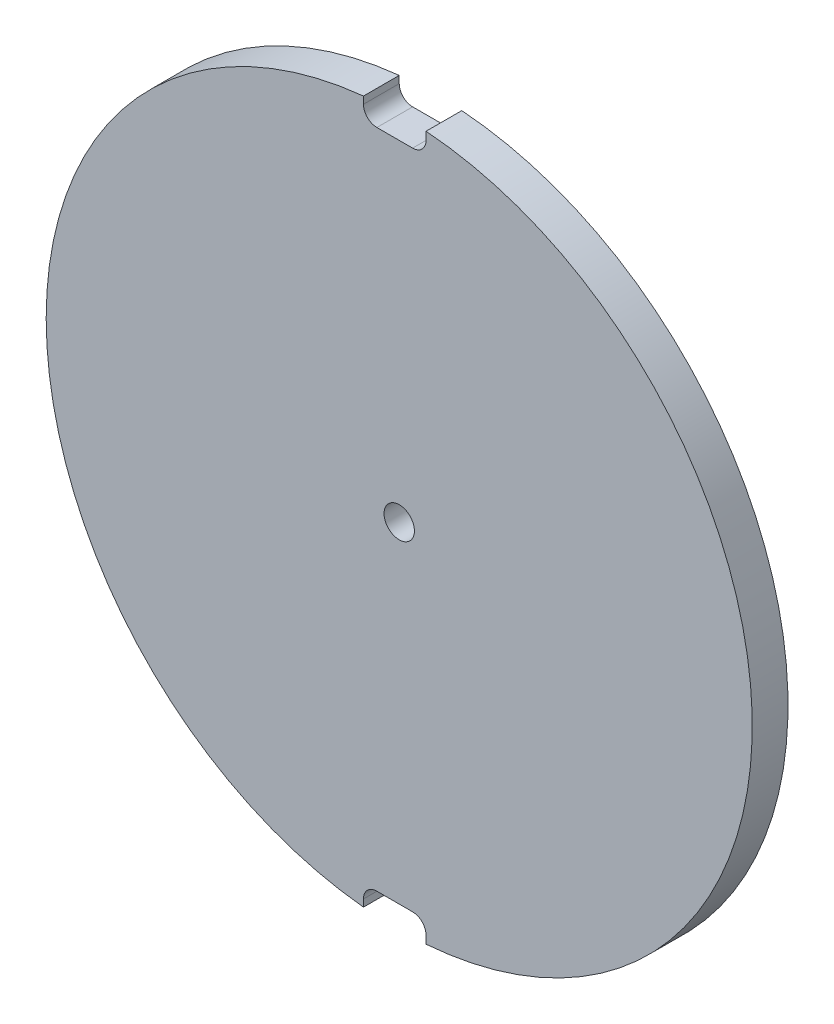
from build123d import *

# Parameters (mm, degrees)
SKETCH1_R           = 39.5
BOSS_EXTRUDE1_DEPTH = 4
CUT_EXTRUDE2_DEPTH  = 10
SKETCH7_R           = 26
BOSS_EXTRUDE2_DEPTH = 7
SKETCH8_R           = 1.7
CUT_EXTRUDE3_DEPTH  = 20
SKETCH9_R           = 5
CUT_EXTRUDE4_DEPTH  = 4


with BuildPart() as part:
    # Sketch1 → Boss-Extrude1 (new body)
    with BuildSketch(Plane.XY):
        with Locations((-12.82554103, 19.238311544)):
            Circle(SKETCH1_R)
    extrude(amount=BOSS_EXTRUDE1_DEPTH)

    # Sketch5 → Cut-Extrude2 (cut)
    with BuildSketch(Plane.XY.offset(4)):
        with BuildLine():
            Line((-16.82554103, 62.183460186), (-16.82554103, 57.738311544))
            ThreePointArc((-16.82554103, 57.738311544), (-16.386201201, 56.677651372), (-15.32554103, 56.238311544))
            Line((-15.32554103, 56.238311544), (-11.32554103, 56.238311544))
            ThreePointArc((-11.32554103, 56.238311544), (-10.264880858, 56.677651372), (-9.82554103, 57.738311544))
            Line((-9.82554103, 57.738311544), (-9.82554103, 62.183460186))
            Line((-9.82554103, 62.183460186), (-16.82554103, 62.183460186))
        make_face()
        with BuildLine():
            Line((-11.32554103, -17.761688456), (-15.32554103, -17.761688456))
            ThreePointArc((-15.32554103, -17.761688456), (-16.386201201, -18.201028284), (-16.82554103, -19.261688456))
            Line((-16.82554103, -19.261688456), (-16.82554103, -24.058644266))
            Line((-16.82554103, -24.058644266), (-9.82554103, -24.058644266))
            Line((-9.82554103, -24.058644266), (-9.82554103, -19.261688456))
            ThreePointArc((-9.82554103, -19.261688456), (-10.264880858, -18.201028284), (-11.32554103, -17.761688456))
        make_face()
    extrude(amount=-CUT_EXTRUDE2_DEPTH, mode=Mode.SUBTRACT)

    # Sketch7 → Boss-Extrude2 (add)
    with BuildSketch(Plane(origin=(0, 0, 0), x_dir=(-1, 0, 0), z_dir=(0, 0, -1))):
        with Locations((12.82554103, 19.238311544)):
            Circle(SKETCH7_R)
    extrude(amount=BOSS_EXTRUDE2_DEPTH)

    # Sketch8 → Cut-Extrude3 (cut)
    with BuildSketch(Plane(origin=(0, 0, -7), x_dir=(-1, 0, 0), z_dir=(0, 0, -1))):
        with Locations((12.82554103, 19.238311544)):
            Circle(SKETCH8_R)
    extrude(amount=-CUT_EXTRUDE3_DEPTH, mode=Mode.SUBTRACT)

    # Sketch9 → Cut-Extrude4 (cut)
    with BuildSketch(Plane(origin=(0, 0, -7), x_dir=(-1, 0, 0), z_dir=(0, 0, -1))):
        with Locations((12.82554103, 19.238311544)):
            Circle(SKETCH9_R)
    extrude(amount=-CUT_EXTRUDE4_DEPTH, mode=Mode.SUBTRACT)


solid = part.part
